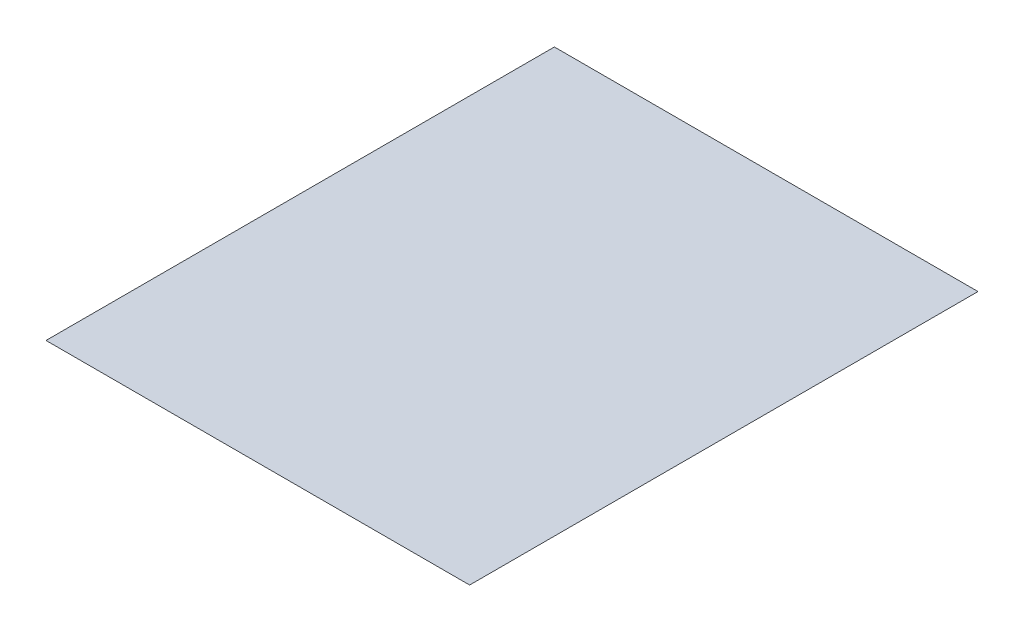
from build123d import *

# Parameters (mm, degrees)
SKETCH1_R           = 5
BOSS_EXTRUDE1_DEPTH = 22.5
BOSS_EXTRUDE4_DEPTH = 10
BOSS_EXTRUDE5_DEPTH = 20
FILLET1_SIZE        = 20
BOSS_EXTRUDE6_DEPTH = 25
BOSS_EXTRUDE7_START = 30
BOSS_EXTRUDE7_DEPTH = 30
FILLET3_SIZE        = 20
SKETCH8_W           = 200
SKETCH8_H           = 240
BOSS_EXTRUDE8_DEPTH = 10
CHAMFER1_SIZE       = 10


# Some blends are built 0.0001 mm under size
with BuildPart() as part:
    # Sketch1 → Boss-Extrude1 (new, symmetric)
    with BuildSketch(Plane.XY):
        with Locations(Location((0, 180, 0), (0, 0, 180))):
            Circle(SKETCH1_R)
    extrude(amount=BOSS_EXTRUDE1_DEPTH, both=True)

    # Sketch4 → Boss-Extrude4 (add)
    with BuildSketch(Plane.XY.offset(22.5)):
        with BuildLine():
            Line((-20, 180), (-20, 205))
            Line((-20, 205), (20, 205))
            Line((20, 205), (20, 180))
            ThreePointArc((20, 180), (0, 160), (-20, 180))
        make_face()
    extrude(amount=BOSS_EXTRUDE4_DEPTH)

    # Sketch5 → Boss-Extrude5 (add)
    with BuildSketch(Plane.XY.offset(32.5)):
        with BuildLine():
            Line((-20, 180), (20, 180))
            ThreePointArc((20, 180), (0, 160), (-20, 180))
        make_face()
    extrude(amount=BOSS_EXTRUDE5_DEPTH)

    # Fillet1
    # a fillet whose section is not a circle: 20 mm, written as the material it takes off along each edge
    with BuildSketch(Plane(origin=(0, 180, 52.5), x_dir=(0.003141587485879206, 0.9999950652018581, 0), z_dir=(-0.9999950652018581, 0.003141587485879206, 0))) as fillet1_piece_1:
        with BuildLine():
            Bezier((20, FILLET1_SIZE), (20, 0), (20 - FILLET1_SIZE, 0), weights=[1, 0.707106781, 1])
            Line((20 - FILLET1_SIZE, 0), (20, 0))
            Line((20, 0), (20, FILLET1_SIZE))
        make_face()
    revolve(axis=Axis((0, 180, 52.5), (0, 0, -1)), revolution_arc=359.64, mode=Mode.SUBTRACT)

    # Sketch6 → Boss-Extrude6 (add)
    with BuildSketch(Plane(origin=(0, 180, 0), x_dir=(1, 0, 0), z_dir=(0, 1, 0))):
        with BuildLine():
            Line((20, -32.5), (-20, -32.5))
            ThreePointArc((-20, -32.5), (0, -52.5), (20, -32.5))
        make_face()
    extrude(amount=BOSS_EXTRUDE6_DEPTH)

    # Sketch7 → Boss-Extrude7 (add)
    with BuildSketch(Plane(origin=(0, 0, -22.5), x_dir=(-1, 0, 0), z_dir=(0, 0, -1)).offset(BOSS_EXTRUDE7_START)):
        with BuildLine():
            Line((20, 180), (20, 205))
            Line((20, 205), (-20, 205))
            Line((-20, 205), (-20, 180))
            ThreePointArc((-20, 180), (0, 160), (20, 180))
        make_face()
    extrude(amount=-BOSS_EXTRUDE7_DEPTH)

    # Fillet3
    # a fillet whose section is not a circle: 20 mm, written as the material it takes off along each edge
    with BuildSketch(Plane(origin=(0, 180, -52.5), x_dir=(1, 0, 0), z_dir=(0, 1, 0))) as fillet3_piece_1:
        with BuildLine():
            Bezier((20, -FILLET3_SIZE), (20, 0), (20 - FILLET3_SIZE, 0), weights=[1, 0.707106781, 1])
            Line((20 - FILLET3_SIZE, 0), (20, 0))
            Line((20, 0), (20, -FILLET3_SIZE))
        make_face()
    revolve(axis=Axis((0, 180, -52.5), (0, 0, -1)), revolution_arc=180, mode=Mode.SUBTRACT)
    with BuildSketch(Plane(origin=(20, 255, -52.5), x_dir=(-1, 0, 0), z_dir=(0, -1, 0))) as fillet3_piece_2:
        with BuildLine():
            Bezier((FILLET3_SIZE, 0), (0, 0), (0, -FILLET3_SIZE), weights=[1, 0.707106781, 1])
            Line((0, -FILLET3_SIZE), (0, 0))
            Line((0, 0), (FILLET3_SIZE, 0))
        make_face()
    extrude(amount=75, mode=Mode.SUBTRACT)
    with BuildSketch(Plane(origin=(-20, 180, -52.5), x_dir=(0, 0, 1), z_dir=(0, 1, 0))) as fillet3_piece_3:
        with BuildLine():
            Bezier((FILLET3_SIZE, 0), (0, 0), (0, FILLET3_SIZE), weights=[1, 0.707106781, 1])
            Line((0, FILLET3_SIZE), (0, 0))
            Line((0, 0), (FILLET3_SIZE, 0))
        make_face()
    extrude(amount=75, mode=Mode.SUBTRACT)

    # Sketch8 → Boss-Extrude8 (add)
    with BuildSketch(Plane(origin=(0, 205, 0), x_dir=(1, 0, 0), z_dir=(0, 1, 0))):
        Rectangle(SKETCH8_W, SKETCH8_H)
    extrude(amount=BOSS_EXTRUDE8_DEPTH)

    # Chamfer1
    chamfer1_edges = [part.edges().sort_by_distance(p)[0] for p in [
        (100, 205, 0),
        (0, 205, -120),
        (-100, 205, 0),
        (0, 205, 120),
    ]]
    chamfer(chamfer1_edges, length=CHAMFER1_SIZE - 0.0001)  # a hair under: the kernel refuses the full size


solid = part.part
